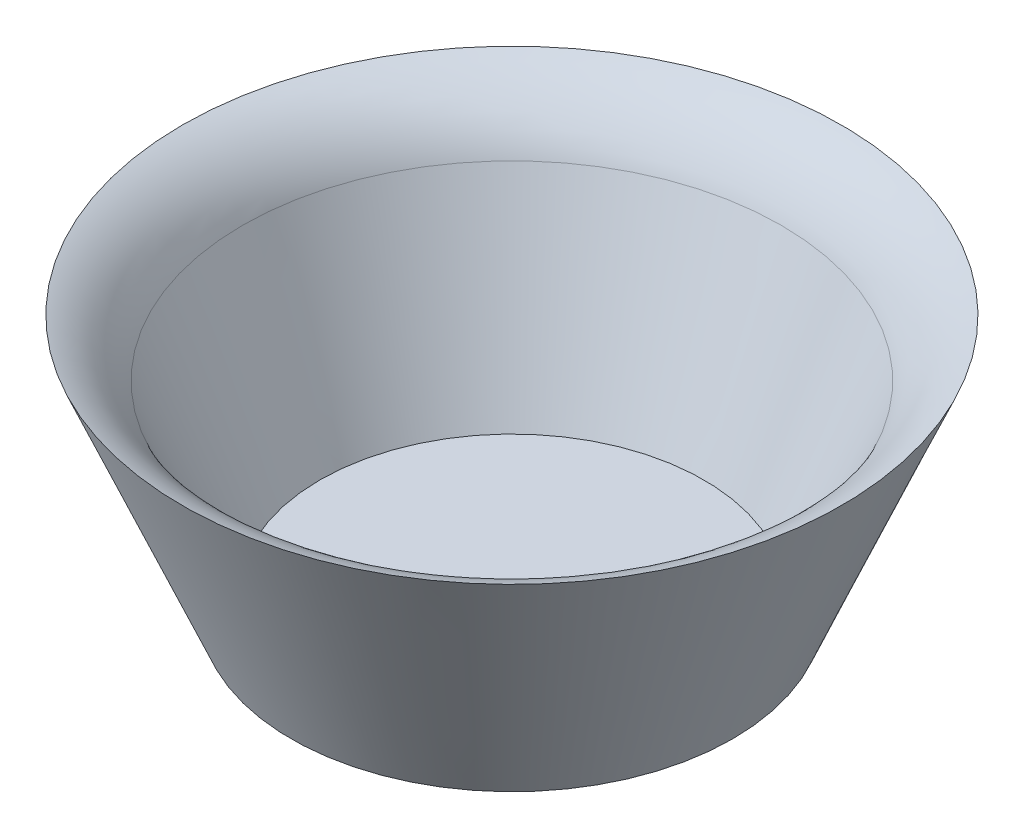
from build123d import *

# Parameters (mm, degrees)
FILLET1_R = 20


with BuildPart() as part:
    # Sketch1 → Revolve1 (revolve)
    with BuildSketch(Plane.XY):
        Polygon((0, 0), (0, -3.5), (-43, -3.5), (-64.22374081, 46.5), (-57.162398357, 46.5), (-37.424319404, 0), align=None)
    revolve(axis=Axis((0, -36.803347039, 0), (0, -1, 0)))

    # Fillet1
    # the kernel refuses this fillet: 20 mm, written as the material it takes off along each edge
    with BuildSketch(Plane(origin=(0, 46.5, 0), x_dir=(-1, 0, 0), z_dir=(0, 0, 1))) as fillet1_piece_1:
        with BuildLine():
            CenterArc((70.884789261, 18.858166229), FILLET1_R, 203, 47.545849796)
            Line((52.474692192, 11.04354366), (52.106490251, 10.887251208))
            Line((52.106490251, 10.887251208), (56.794196416, -0.156292451))
            Line((56.794196416, -0.156292451), (57.162398357, -0.4))
            ThreePointArc((57.162398357, -0.4), (60.693069584, -0.4), (64.090519841, -0.377163325))
            Line((64.090519841, -0.377163325), (64.22374081, 0))
        make_face()
    revolve(axis=Axis((0, 46.5, 0), (0, -1, 0)), mode=Mode.SUBTRACT)


solid = part.part
